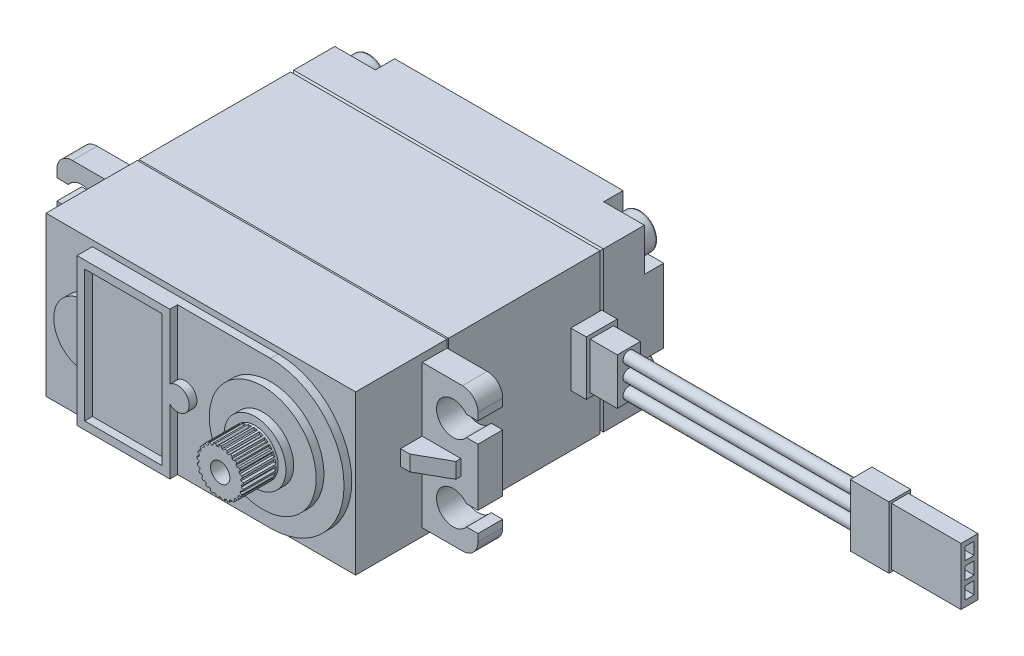
from build123d import *

# Parameters (mm, degrees)
SKETCH_1_W           = 40
SKETCH_1_H           = 20.5
EXTRUDE_1_DEPTH      = 8
CHAMFER_1_SIZE       = 0.2
SKETCH_2_W           = 40
SKETCH_2_H           = 20.5
EXTRUDE_2_DEPTH      = 20
CHAMFER_4_SIZE       = 0.2
CHAMFER_5_SIZE       = 0.2
SKETCH_3_W           = 40
SKETCH_3_H           = 20.5
EXTRUDE_3_DEPTH      = 12.8
SKETCH_4_R           = 6.9
EXTRUDE_4_DEPTH      = 2
SKETCH_5_R           = 3
EXTRUDE_5_DEPTH      = 4.5
EXTRUDE_6_DEPTH      = 3.2
SKETCH_9_W           = 5
SKETCH_9_H           = 2
EXTRUDE_7_DEPTH      = 2.8
CUT_EXTRUDE_6_DEPTH  = 2.8
SKETCH_11_R          = 1.25
CUT_EXTRUDE_7_DEPTH  = 6
CUT_EXTRUDE_START    = -4.2
CUT_EXTRUDE_8_DEPTH  = 4.2
SKETCH_13_W          = 40
SKETCH_13_H          = 20.5
CUT_EXTRUDE_9_DEPTH  = 1
FILLET_1_R           = 2
SKETCH_17_W          = 4
SKETCH_17_H          = 7
EXTRUDE_8_DEPTH      = 2
SKETCH_18_W          = 3
SKETCH_18_H          = 6
EXTRUDE_9_DEPTH      = 3.5
SKETCH_19_R          = 0.75
EXTRUDE_10_DEPTH     = 30
SKETCH_20_W          = 2.8
SKETCH_20_H          = 8
EXTRUDE_11_DEPTH     = 5
SKETCH_21_W          = 2.2
SKETCH_21_H          = 7.4
SKETCH_21_W_2        = 1.190046005
SKETCH_21_H_2        = 1.6
EXTRUDE_12_DEPTH     = 9
CUT_EXTRUDE_13_DEPTH = 2.5
SKETCH_23_R          = 2.25
EXTRUDE_13_DEPTH     = 2
FILLET_2_R           = 0.3
SKETCH_25_R          = 4
EXTRUDE_15_DEPTH     = 1
SKETCH_26_W          = 12
SKETCH_26_H          = 19
SKETCH_26_W_2        = 10
SKETCH_26_H_2        = 17
EXTRUDE_16_DEPTH     = 1
CUT_EXTRUDE_START_2  = -1
SKETCH_27_R          = 6.9
SKETCH_27_R_2        = 4
CUT_EXTRUDE_14_DEPTH = 1
SKETCH_28_R          = 1.5
EXTRUDE_17_DEPTH     = 1


with BuildPart() as part:
    # 草图1 → 凸台-拉伸1 (new body)
    with BuildSketch(Plane.XY):
        Rectangle(SKETCH_1_W, SKETCH_1_H)
    extrude(amount=EXTRUDE_1_DEPTH)

    # 倒角1
    chamfer_1_edges = [part.edges().sort_by_distance(p)[0] for p in [
        (20, 0, 8),
        (0, 10.25, 8),
        (-20, 0, 8),
        (0, -10.25, 8),
    ]]
    chamfer(chamfer_1_edges, length=CHAMFER_1_SIZE)

    # 草图2 → 凸台-拉伸2 (add)
    with BuildSketch(Plane.XY.offset(8)):
        Rectangle(SKETCH_2_W, SKETCH_2_H)
    extrude(amount=EXTRUDE_2_DEPTH)

    # 倒角4
    chamfer_4_edges = [part.edges().sort_by_distance(p)[0] for p in [
        (0, 10.25, 8),
        (-20, 0, 8),
        (0, -10.25, 8),
        (20, 0, 8),
    ]]
    chamfer(chamfer_4_edges, length=CHAMFER_4_SIZE - 0.0001)  # a hair under: the kernel refuses the full size

    # 倒角5
    chamfer_5_edges = [part.edges().sort_by_distance(p)[0] for p in [
        (0, 10.25, 28),
        (-20, 0, 28),
        (0, -10.25, 28),
        (20, 0, 28),
    ]]
    chamfer(chamfer_5_edges, length=CHAMFER_5_SIZE)

    # 草图3 → 凸台-拉伸3 (add)
    with BuildSketch(Plane.XY.offset(28)):
        Rectangle(SKETCH_3_W, SKETCH_3_H)
    extrude(amount=EXTRUDE_3_DEPTH)

    # 草图4 → 凸台-拉伸4 (add)
    with BuildSketch(Plane.XY.offset(40.8)):
        with Locations(Location((10, 0, 0), (0, 0, 180))):
            Circle(SKETCH_4_R)
    extrude(amount=EXTRUDE_4_DEPTH)

    # 草图5 → 凸台-拉伸5 (add)
    with BuildSketch(Plane.XY.offset(42.8)):
        with Locations((10, 0)):
            Circle(SKETCH_5_R)
    extrude(amount=EXTRUDE_5_DEPTH)

    # 草图8 → 凸台-拉伸6 (add)
    with BuildSketch(Plane.XY.offset(28)):
        with BuildLine():
            Line((-27.2, 9.25), (-27.2, 6.3))
            Line((-27.2, 6.3), (-25.712454379, 6.3))
            ThreePointArc((-25.712454379, 6.3), (-21.85, 5), (-25.712454379, 3.7))
            Line((-25.712454379, 3.7), (-27.2, 3.7))
            Line((-27.2, 3.7), (-27.2, -3.7))
            Line((-27.2, -3.7), (-25.712454379, -3.7))
            ThreePointArc((-25.712454379, -3.7), (-21.85, -5), (-25.712454379, -6.3))
            Line((-25.712454379, -6.3), (-27.2, -6.3))
            Line((-27.2, -6.3), (-27.2, -9.25))
            Line((-27.2, -9.25), (-20, -9.25))
            Line((-20, -9.25), (-20, 9.25))
            Line((-20, 9.25), (-27.2, 9.25))
        make_face()
        with BuildLine():
            Line((20, -9.25), (27.2, -9.25))
            Line((27.2, -9.25), (27.2, -6.3))
            Line((27.2, -6.3), (25.712454379, -6.3))
            ThreePointArc((25.712454379, -6.3), (21.85, -5), (25.712454379, -3.7))
            Line((25.712454379, -3.7), (27.2, -3.7))
            Line((27.2, -3.7), (27.2, 3.7))
            Line((27.2, 3.7), (25.712454379, 3.7))
            ThreePointArc((25.712454379, 3.7), (21.85, 5), (25.712454379, 6.3))
            Line((25.712454379, 6.3), (27.2, 6.3))
            Line((27.2, 6.3), (27.2, 9.25))
            Line((27.2, 9.25), (20, 9.25))
            Line((20, 9.25), (20, -9.25))
        make_face()
    extrude(amount=EXTRUDE_6_DEPTH)

    # 草图9 → 凸台-拉伸7 (add)
    with BuildSketch(Plane.XY.offset(31.2)):
        with Locations((-22.5, 0)):
            Rectangle(SKETCH_9_W, SKETCH_9_H)
        with Locations((22.5, 0)):
            Rectangle(SKETCH_9_W, SKETCH_9_H)
    extrude(amount=EXTRUDE_7_DEPTH)

    # 草图10 → 切除-拉伸6 (cut)
    with BuildSketch(Plane.XZ.offset(1)):
        Polygon((-25, 31.856513204), (-21.19303932, 34), (-25, 34), align=None)
        Polygon((25, 34), (25, 31.856513204), (21.19303932, 34), align=None)
    extrude(amount=-CUT_EXTRUDE_6_DEPTH, mode=Mode.SUBTRACT)

    # 草图11 → 切除-拉伸7 (cut)
    with BuildSketch(Plane.XY.offset(47.3)):
        with Locations((10, 0)):
            Circle(SKETCH_11_R)
    extrude(amount=-CUT_EXTRUDE_7_DEPTH, mode=Mode.SUBTRACT)

    # 草图12 → 切除-拉伸8 (cut)
    with BuildSketch(Plane.XY.offset(47.3).offset(CUT_EXTRUDE_START)):
        with BuildLine():
            Line((9.76, 2.739507255), (9.88, 2.997599039))
            ThreePointArc((9.88, 2.997599039), (9.624000299, 2.976344104), (9.370757413, 2.93326674))
            Line((9.370757413, 2.93326674), (9.551172209, 2.71312617))
            ThreePointArc((9.551172209, 2.71312617), (9.655333608, 2.728315429), (9.76, 2.739507255))
        make_face()
        with BuildLine():
            Line((10.24, 2.739507255), (10.12, 2.997599039))
            ThreePointArc((10.12, 2.997599039), (10.375999701, 2.976344104), (10.629242587, 2.93326674))
            Line((10.629242587, 2.93326674), (10.448827791, 2.71312617))
            ThreePointArc((10.448827791, 2.71312617), (10.344666392, 2.728315429), (10.24, 2.739507255))
        make_face()
        with BuildLine():
            Line((10.913747709, 2.593755024), (10.861702546, 2.873581167))
            ThreePointArc((10.861702546, 2.873581167), (11.104373658, 2.789329458), (11.338947549, 2.684626503))
            Line((11.338947549, 2.684626503), (11.109454082, 2.516269389))
            ThreePointArc((11.109454082, 2.516269389), (11.01234252, 2.556885336), (10.913747709, 2.593755024))
        make_face()
        with BuildLine():
            Line((11.530081289, 2.285027626), (11.549261152, 2.569005621))
            ThreePointArc((11.549261152, 2.569005621), (11.763355757, 2.427050983), (11.964521512, 2.26730131))
            Line((11.964521512, 2.26730131), (11.700369292, 2.161306149))
            ThreePointArc((11.700369292, 2.161306149), (11.616409444, 2.224796735), (11.530081289, 2.285027626))
        make_face()
        with BuildLine():
            Line((12.050274234, 1.832723538), (12.139473982, 2.103010004))
            ThreePointArc((12.139473982, 2.103010004), (12.311539728, 1.912271969), (12.466657363, 1.707513237))
            Line((12.466657363, 1.707513237), (12.184444047, 1.670540094))
            ThreePointArc((12.184444047, 1.670540094), (12.118911418, 1.752915972), (12.050274234, 1.832723538))
        make_face()
        with BuildLine():
            Line((12.441640908, 1.26526269), (12.595255794, 1.504874535))
            ThreePointArc((12.595255794, 1.504874535), (12.714481157, 1.277337875), (12.81380406, 1.040435827))
            Line((12.81380406, 1.040435827), (12.531262148, 1.074807862))
            ThreePointArc((12.531262148, 1.074807862), (12.488274394, 1.170893052), (12.441640908, 1.26526269))
        make_face()
        with BuildLine():
            Line((12.679590305, 0.618300734), (12.887968139, 0.812182263))
            ThreePointArc((12.887968139, 0.812182263), (12.946861752, 0.562143944), (12.9841491, 0.307984008))
            Line((12.9841491, 0.307984008), (12.719031738, 0.411541499))
            ThreePointArc((12.719031738, 0.411541499), (12.70128994, 0.515298615), (12.679590305, 0.618300734))
        make_face()
        with BuildLine():
            Line((12.749171188, -0.067511331), (12.999218825, 0.068457594))
            ThreePointArc((12.999218825, 0.068457594), (12.994080185, -0.188371559), (12.966989077, -0.443819578))
            Line((12.966989077, -0.443819578), (12.735954565, -0.277583531))
            ThreePointArc((12.735954565, -0.277583531), (12.744573503, -0.172673929), (12.749171188, -0.067511331))
        make_face()
        with BuildLine():
            Line((12.646011534, -0.749081411), (12.922017561, -0.679568519))
            ThreePointArc((12.922017561, -0.679568519), (12.853169549, -0.927050983), (12.763402218, -1.167736349))
            Line((12.763402218, -1.167736349), (12.580967305, -0.949266966))
            ThreePointArc((12.580967305, -0.949266966), (12.61540542, -0.849796735), (12.646011534, -0.749081411))
        make_face()
        with BuildLine():
            Line((12.376593245, -1.383583951), (12.661215188, -1.384894842))
            ThreePointArc((12.661215188, -1.384894842), (12.532983777, -1.607480385), (12.386180635, -1.81827995))
            Line((12.386180635, -1.81827995), (12.263808376, -1.561304466))
            ThreePointArc((12.263808376, -1.561304466), (12.321901795, -1.473523686), (12.376593245, -1.383583951))
        make_face()
        with BuildLine():
            Line((11.957844861, -1.931150823), (12.233198877, -2.003203128))
            ThreePointArc((12.233198877, -2.003203128), (12.053641318, -2.186905882), (11.859026547, -2.354574335))
            Line((11.859026547, -2.354574335), (11.804406042, -2.075239465))
            ThreePointArc((11.804406042, -2.075239465), (11.882504541, -2.004663725), (11.957844861, -1.931150823))
        make_face()
        with BuildLine():
            Line((11.416077884, -2.357376386), (11.664862468, -2.495642795))
            ThreePointArc((11.664862468, -2.495642795), (11.445261022, -2.62892004), (11.215062984, -2.742922154))
            Line((11.215062984, -2.742922154), (11.231626239, -2.458779536))
            ThreePointArc((11.231626239, -2.458779536), (11.324822604, -2.40984337), (11.416077884, -2.357376386))
        make_face()
        with BuildLine():
            Line((10.785333526, -2.635479321), (10.991916627, -2.831272047))
            ThreePointArc((10.991916627, -2.831272047), (10.746069661, -2.905749483), (10.494752545, -2.958922087))
            Line((10.494752545, -2.958922087), (10.581458831, -2.687825446))
            ThreePointArc((10.581458831, -2.687825446), (10.68389719, -2.663603693), (10.785333526, -2.635479321))
        make_face()
        with BuildLine():
            Line((10.105243774, -2.747985398), (10.256645016, -2.989002063))
            ThreePointArc((10.256645016, -2.989002063), (10, -3), (9.743354984, -2.989002063))
            Line((9.743354984, -2.989002063), (9.894756226, -2.747985398))
            ThreePointArc((9.894756226, -2.747985398), (10, -2.75), (10.105243774, -2.747985398))
        make_face()
        with BuildLine():
            Line((9.418541169, -2.687825446), (9.505247455, -2.958922087))
            ThreePointArc((9.505247455, -2.958922087), (9.253930339, -2.905749483), (9.008083373, -2.831272047))
            Line((9.008083373, -2.831272047), (9.214666474, -2.635479321))
            ThreePointArc((9.214666474, -2.635479321), (9.31610281, -2.663603693), (9.418541169, -2.687825446))
        make_face()
        with BuildLine():
            Line((8.768373761, -2.458779536), (8.784937016, -2.742922154))
            ThreePointArc((8.784937016, -2.742922154), (8.554738978, -2.62892004), (8.335137532, -2.495642795))
            Line((8.335137532, -2.495642795), (8.583922116, -2.357376386))
            ThreePointArc((8.583922116, -2.357376386), (8.675177396, -2.40984337), (8.768373761, -2.458779536))
        make_face()
        with BuildLine():
            Line((8.195593958, -2.075239465), (8.140973453, -2.354574335))
            ThreePointArc((8.140973453, -2.354574335), (7.946358682, -2.186905882), (7.766801123, -2.003203128))
            Line((7.766801123, -2.003203128), (8.042155139, -1.931150823))
            ThreePointArc((8.042155139, -1.931150823), (8.117495459, -2.004663725), (8.195593958, -2.075239465))
        make_face()
        with BuildLine():
            Line((7.736191624, -1.561304466), (7.613819365, -1.81827995))
            ThreePointArc((7.613819365, -1.81827995), (7.467016223, -1.607480385), (7.338784812, -1.384894842))
            Line((7.338784812, -1.384894842), (7.623406755, -1.383583951))
            ThreePointArc((7.623406755, -1.383583951), (7.678098205, -1.473523686), (7.736191624, -1.561304466))
        make_face()
        with BuildLine():
            Line((7.419032695, -0.949266966), (7.236597782, -1.167736349))
            ThreePointArc((7.236597782, -1.167736349), (7.146830451, -0.927050983), (7.077982439, -0.679568519))
            Line((7.077982439, -0.679568519), (7.353988466, -0.749081411))
            ThreePointArc((7.353988466, -0.749081411), (7.38459458, -0.849796735), (7.419032695, -0.949266966))
        make_face()
        with BuildLine():
            Line((7.264045435, -0.277583531), (7.033010923, -0.443819578))
            ThreePointArc((7.033010923, -0.443819578), (7.005919815, -0.188371559), (7.000781175, 0.068457594))
            Line((7.000781175, 0.068457594), (7.250828812, -0.067511331))
            ThreePointArc((7.250828812, -0.067511331), (7.255426497, -0.172673929), (7.264045435, -0.277583531))
        make_face()
        with BuildLine():
            Line((7.280968262, 0.411541499), (7.0158509, 0.307984008))
            ThreePointArc((7.0158509, 0.307984008), (7.053138248, 0.562143944), (7.112031861, 0.812182263))
            Line((7.112031861, 0.812182263), (7.320409695, 0.618300734))
            ThreePointArc((7.320409695, 0.618300734), (7.29871006, 0.515298615), (7.280968262, 0.411541499))
        make_face()
        with BuildLine():
            Line((7.468737852, 1.074807862), (7.18619594, 1.040435827))
            ThreePointArc((7.18619594, 1.040435827), (7.285518843, 1.277337875), (7.404744206, 1.504874535))
            Line((7.404744206, 1.504874535), (7.558359092, 1.26526269))
            ThreePointArc((7.558359092, 1.26526269), (7.511725606, 1.170893052), (7.468737852, 1.074807862))
        make_face()
        with BuildLine():
            Line((7.815555953, 1.670540094), (7.533342637, 1.707513237))
            ThreePointArc((7.533342637, 1.707513237), (7.688460272, 1.912271969), (7.860526018, 2.103010004))
            Line((7.860526018, 2.103010004), (7.949725766, 1.832723538))
            ThreePointArc((7.949725766, 1.832723538), (7.881088582, 1.752915972), (7.815555953, 1.670540094))
        make_face()
        with BuildLine():
            Line((8.299630708, 2.161306149), (8.035478488, 2.26730131))
            ThreePointArc((8.035478488, 2.26730131), (8.236644243, 2.427050983), (8.450738848, 2.569005621))
            Line((8.450738848, 2.569005621), (8.469918711, 2.285027626))
            ThreePointArc((8.469918711, 2.285027626), (8.383590556, 2.224796735), (8.299630708, 2.161306149))
        make_face()
        with BuildLine():
            Line((8.890545918, 2.516269389), (8.661052451, 2.684626503))
            ThreePointArc((8.661052451, 2.684626503), (8.895626342, 2.789329458), (9.138297454, 2.873581167))
            Line((9.138297454, 2.873581167), (9.086252291, 2.593755024))
            ThreePointArc((9.086252291, 2.593755024), (8.98765748, 2.556885336), (8.890545918, 2.516269389))
        make_face()
    extrude(amount=CUT_EXTRUDE_8_DEPTH, mode=Mode.SUBTRACT)

    # 草图13 → 切除-拉伸9 (cut)
    with BuildSketch(Plane.XY.offset(40.8)):
        Rectangle(SKETCH_13_W, SKETCH_13_H)
        with BuildLine():
            Line((10, 9.5), (-14, 9.5))
            Line((-14, 9.5), (-14, -9.5))
            Line((-14, -9.5), (10, -9.5))
            ThreePointArc((10, -9.5), (19.5, 0), (10, 9.5))
        make_face(mode=Mode.SUBTRACT)
    extrude(amount=-CUT_EXTRUDE_9_DEPTH, mode=Mode.SUBTRACT)

    # 圆角1
    fillet_1_edges = [part.edges().sort_by_distance(p)[0] for p in [
        (-27.2, 9.25, 29.6),
        (-27.2, -9.25, 29.6),
        (27.2, -9.25, 29.6),
        (27.2, 9.25, 29.6),
    ]]
    fillet(fillet_1_edges, radius=FILLET_1_R)

    # 草图17 → 凸台-拉伸8 (add)
    with BuildSketch(Plane(origin=(20, 0, 0), x_dir=(0, 0, -1), z_dir=(1, 0, 0))):
        with Locations((-10, 0)):
            Rectangle(SKETCH_17_W, SKETCH_17_H)
    extrude(amount=EXTRUDE_8_DEPTH)

    # 草图18 → 凸台-拉伸9 (add)
    with BuildSketch(Plane(origin=(22, 0, 0), x_dir=(0, 0, -1), z_dir=(1, 0, 0))):
        with Locations((-10, 0)):
            Rectangle(SKETCH_18_W, SKETCH_18_H)
    extrude(amount=EXTRUDE_9_DEPTH)

    # 草图19 → 凸台-拉伸10 (add)
    with BuildSketch(Plane(origin=(25.5, 0, 0), x_dir=(0, 0, -1), z_dir=(1, 0, 0))):
        with Locations((-10, 0)):
            Circle(SKETCH_19_R)
        with Locations((-10, 2)):
            Circle(SKETCH_19_R)
        with Locations((-10, -2)):
            Circle(SKETCH_19_R)
    extrude(amount=EXTRUDE_10_DEPTH)

    # 草图20 → 凸台-拉伸11 (add)
    with BuildSketch(Plane(origin=(55.5, 0, 0), x_dir=(0, 0, -1), z_dir=(1, 0, 0))):
        with Locations((-10, 0)):
            Rectangle(SKETCH_20_W, SKETCH_20_H)
    extrude(amount=EXTRUDE_11_DEPTH)

    # 草图21 → 凸台-拉伸12 (add)
    with BuildSketch(Plane(origin=(60.5, 0, 0), x_dir=(0, 0, -1), z_dir=(1, 0, 0))):
        with Locations((-10, 0)):
            Rectangle(SKETCH_21_W, SKETCH_21_H)
        with Locations((-9.995023003, 2.3)):
            Rectangle(SKETCH_21_W_2, SKETCH_21_H_2, mode=Mode.SUBTRACT)
        with Locations((-9.995023003, 0.1)):
            Rectangle(SKETCH_21_W_2, SKETCH_21_H_2, mode=Mode.SUBTRACT)
        with Locations((-9.995023003, -2.1)):
            Rectangle(SKETCH_21_W_2, SKETCH_21_H_2, mode=Mode.SUBTRACT)
    extrude(amount=EXTRUDE_12_DEPTH)

    # 草图22 → 切除-拉伸13 (cut)
    with BuildSketch(Plane(origin=(0, 0, 0), x_dir=(-1, 0, 0), z_dir=(0, 0, -1))):
        with BuildLine():
            Line((-20, 4.75), (-20, 10.25))
            Line((-20, 10.25), (-14.75, 10.25))
            Line((-14.75, 10.25), (-14.75, 7.5))
            ThreePointArc((-14.75, 7.5), (-15.555456352, 5.555456352), (-17.5, 4.75))
            Line((-17.5, 4.75), (-20, 4.75))
        make_face()
        with BuildLine():
            Line((-17.5, -4.75), (-20, -4.75))
            Line((-20, -4.75), (-20, -10.25))
            Line((-20, -10.25), (-14.75, -10.25))
            Line((-14.75, -10.25), (-14.75, -7.5))
            ThreePointArc((-14.75, -7.5), (-15.555456352, -5.555456352), (-17.5, -4.75))
        make_face()
        with BuildLine():
            Line((14.75, -7.5), (14.75, -10.25))
            Line((14.75, -10.25), (20, -10.25))
            Line((20, -10.25), (20, -4.75))
            Line((20, -4.75), (17.5, -4.75))
            ThreePointArc((17.5, -4.75), (15.555456352, -5.555456352), (14.75, -7.5))
        make_face()
        with BuildLine():
            Line((20, 4.75), (20, 10.25))
            Line((20, 10.25), (14.75, 10.25))
            Line((14.75, 10.25), (14.75, 7.5))
            ThreePointArc((14.75, 7.5), (15.555456352, 5.555456352), (17.5, 4.75))
            Line((17.5, 4.75), (20, 4.75))
        make_face()
    extrude(amount=-CUT_EXTRUDE_13_DEPTH, mode=Mode.SUBTRACT)

    # 草图23 → 凸台-拉伸13 (add)
    # profile 1 of 4: a face of its own
    with BuildSketch(Plane(origin=(0, 0, 2.5), x_dir=(-1, 0, 0), z_dir=(0, 0, -1))):
        with Locations(Location((-17.5, 7.5, 0), (0, 0, 180))):
            Circle(SKETCH_23_R)
        with BuildLine():
            Line((-17.25, 7.25), (-17.25, 5.61651918))
            ThreePointArc((-17.25, 5.61651918), (-17.5, 5.6), (-17.75, 5.61651918))
            Line((-17.75, 5.61651918), (-17.75, 7.25))
            Line((-17.75, 7.25), (-19.38348082, 7.25))
            ThreePointArc((-19.38348082, 7.25), (-19.4, 7.5), (-19.38348082, 7.75))
            Line((-19.38348082, 7.75), (-17.75, 7.75))
            Line((-17.75, 7.75), (-17.75, 9.38348082))
            ThreePointArc((-17.75, 9.38348082), (-17.5, 9.4), (-17.25, 9.38348082))
            Line((-17.25, 9.38348082), (-17.25, 7.75))
            Line((-17.25, 7.75), (-15.61651918, 7.75))
            ThreePointArc((-15.61651918, 7.75), (-15.6, 7.5), (-15.61651918, 7.25))
            Line((-15.61651918, 7.25), (-17.25, 7.25))
        make_face(mode=Mode.SUBTRACT)
    # profile 2 of 4: a face of its own
    with BuildSketch(Plane(origin=(0, 0, 2.5), x_dir=(-1, 0, 0), z_dir=(0, 0, -1))):
        with Locations(Location((-17.5, -7.5, 0), (0, 0, 180))):
            Circle(SKETCH_23_R)
        with BuildLine():
            Line((-17.25, -7.75), (-15.61651918, -7.75))
            ThreePointArc((-15.61651918, -7.75), (-15.6, -7.5), (-15.61651918, -7.25))
            Line((-15.61651918, -7.25), (-17.25, -7.25))
            Line((-17.25, -7.25), (-17.25, -5.61651918))
            ThreePointArc((-17.25, -5.61651918), (-17.5, -5.6), (-17.75, -5.61651918))
            Line((-17.75, -5.61651918), (-17.75, -7.25))
            Line((-17.75, -7.25), (-19.38348082, -7.25))
            ThreePointArc((-19.38348082, -7.25), (-19.4, -7.5), (-19.38348082, -7.75))
            Line((-19.38348082, -7.75), (-17.75, -7.75))
            Line((-17.75, -7.75), (-17.75, -9.38348082))
            ThreePointArc((-17.75, -9.38348082), (-17.5, -9.4), (-17.25, -9.38348082))
            Line((-17.25, -9.38348082), (-17.25, -7.75))
        make_face(mode=Mode.SUBTRACT)
    # profile 3 of 4: a face of its own
    with BuildSketch(Plane(origin=(0, 0, 2.5), x_dir=(-1, 0, 0), z_dir=(0, 0, -1))):
        with Locations(Location((17.5, -7.5, 0), (0, 0, 180))):
            Circle(SKETCH_23_R)
        with BuildLine():
            Line((17.25, -7.25), (15.61651918, -7.25))
            ThreePointArc((15.61651918, -7.25), (15.6, -7.5), (15.61651918, -7.75))
            Line((15.61651918, -7.75), (17.25, -7.75))
            Line((17.25, -7.75), (17.25, -9.38348082))
            ThreePointArc((17.25, -9.38348082), (17.5, -9.4), (17.75, -9.38348082))
            Line((17.75, -9.38348082), (17.75, -7.75))
            Line((17.75, -7.75), (19.38348082, -7.75))
            ThreePointArc((19.38348082, -7.75), (19.4, -7.5), (19.38348082, -7.25))
            Line((19.38348082, -7.25), (17.75, -7.25))
            Line((17.75, -7.25), (17.75, -5.61651918))
            ThreePointArc((17.75, -5.61651918), (17.5, -5.6), (17.25, -5.61651918))
            Line((17.25, -5.61651918), (17.25, -7.25))
        make_face(mode=Mode.SUBTRACT)
    # profile 4 of 4: a face of its own
    with BuildSketch(Plane(origin=(0, 0, 2.5), x_dir=(-1, 0, 0), z_dir=(0, 0, -1))):
        with Locations(Location((17.5, 7.5, 0), (0, 0, 180))):
            Circle(SKETCH_23_R)
        with BuildLine():
            Line((19.38348082, 7.25), (17.75, 7.25))
            Line((17.75, 7.25), (17.75, 5.61651918))
            ThreePointArc((17.75, 5.61651918), (17.5, 5.6), (17.25, 5.61651918))
            Line((17.25, 5.61651918), (17.25, 7.25))
            Line((17.25, 7.25), (15.61651918, 7.25))
            ThreePointArc((15.61651918, 7.25), (15.6, 7.5), (15.61651918, 7.75))
            Line((15.61651918, 7.75), (17.25, 7.75))
            Line((17.25, 7.75), (17.25, 9.38348082))
            ThreePointArc((17.25, 9.38348082), (17.5, 9.4), (17.75, 9.38348082))
            Line((17.75, 9.38348082), (17.75, 7.75))
            Line((17.75, 7.75), (19.38348082, 7.75))
            ThreePointArc((19.38348082, 7.75), (19.4, 7.5), (19.38348082, 7.25))
        make_face(mode=Mode.SUBTRACT)
    extrude(amount=EXTRUDE_13_DEPTH)

    # 圆角2
    fillet_2_edges = [part.edges().sort_by_distance(p)[0] for p in [
        (15.25, 7.5, 0.5),
        (15.25, -7.5, 0.5),
        (-19.75, -7.5, 0.5),
        (-19.75, 7.5, 0.5),
    ]]
    fillet(fillet_2_edges, radius=FILLET_2_R)

    # 草图25 → 凸台-拉伸15 (add)
    with BuildSketch(Plane.XY.offset(40.8)):
        with Locations((-14, 0)):
            Circle(SKETCH_25_R)
    extrude(amount=-EXTRUDE_15_DEPTH)

    # 草图26 → 凸台-拉伸16 (add)
    with BuildSketch(Plane.XY.offset(40.8)):
        with Locations((-8, 0)):
            Rectangle(SKETCH_26_W, SKETCH_26_H)
        with Locations((-8, 0)):
            Rectangle(SKETCH_26_W_2, SKETCH_26_H_2, mode=Mode.SUBTRACT)
    extrude(amount=EXTRUDE_16_DEPTH)

    # 草图27 → 切除-拉伸14 (cut)
    with BuildSketch(Plane.XY.offset(42.8).offset(CUT_EXTRUDE_START_2)):
        with Locations(Location((10, 0, 0), (0, 0, 180))):
            Circle(SKETCH_27_R)
        with Locations((10, 0)):
            Circle(SKETCH_27_R_2, mode=Mode.SUBTRACT)
    extrude(amount=CUT_EXTRUDE_14_DEPTH, mode=Mode.SUBTRACT)

    # 草图28 → 凸台-拉伸17 (add)
    with BuildSketch(Plane.XY.offset(40.8)):
        with Locations((-1, 0)):
            Circle(SKETCH_28_R)
    extrude(amount=EXTRUDE_17_DEPTH)


solid = part.part
